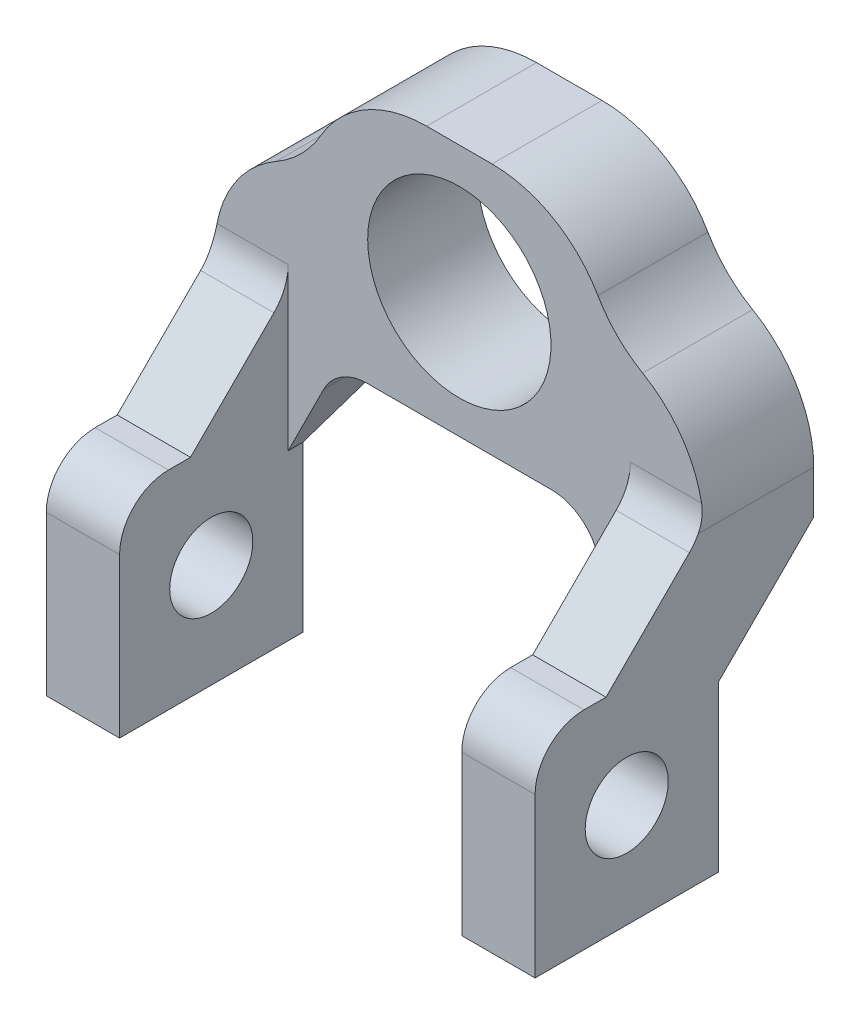
from build123d import *

# Parameters (mm, degrees)
SALIENTE_EXTRUIR1_DEPTH = 20
CORTAR_EXTRUIR1_START   = -6.736039
CROQUIS2_W              = 14
CROQUIS2_H              = 7.5
CORTAR_EXTRUIR1_DEPTH   = 6.736039
CORTAR_EXTRUIR2_REACH   = 29.226
CROQUIS3_R              = 1.7
CROQUIS5_W              = 14
CROQUIS5_H              = 5.763961031
CORTAR_EXTRUIR4_DEPTH   = 10
CORTAR_EXTRUIR3_REACH   = 30.507
CROQUIS4_R              = 3.75
CROQUIS4_W              = 5
CROQUIS4_H              = 5
REDONDEO1_R             = 5
REDONDEO2_R             = 5
REDONDEO3_R             = 2


# Some blends are built 0.0001 mm under size
with BuildPart() as part:
    # Croquis1 → Saliente-Extruir1 (new body)
    with BuildSketch(Plane(origin=(0, 0, 0), x_dir=(0, 0, -1), z_dir=(1, 0, 0))):
        Polygon((-3.75, 4.25), (-0.85, 4.25), (3.15, 8.25), (3.15, 16.813961031), (7.65, 16.813961031), (7.65, 6.386038969), (3.75, 2.486038969), (3.75, -4.25), (-3.75, -4.25), align=None)
    extrude(amount=SALIENTE_EXTRUIR1_DEPTH)

    # Croquis2 → Cortar-Extruir1 (cut)
    with BuildSketch(Plane.XZ.offset(4.25).offset(CORTAR_EXTRUIR1_START)):
        with Locations((10, 0)):
            Rectangle(CROQUIS2_W, CROQUIS2_H)
    extrude(amount=CORTAR_EXTRUIR1_DEPTH, mode=Mode.SUBTRACT)

    # Cortar-Extruir2: up to this face of the body (flat: up to its plane)
    cortar_extruir2_end = Plane(part.part.faces().sort_by_distance((20, 4.974035109, -2.43613322))[0])
    # Croquis3 → Cortar-Extruir2 (cut, up to the picked face)
    with BuildSketch(Plane.ZY, mode=Mode.PRIVATE) as cortar_extruir2_sk1:
        Circle(CROQUIS3_R)
    cortar_extruir2_tool1 = split(extrude(cortar_extruir2_sk1.sketch, amount=-CORTAR_EXTRUIR2_REACH, mode=Mode.PRIVATE), bisect_by=cortar_extruir2_end, keep=Keep.BOTH, mode=Mode.PRIVATE)
    add(cortar_extruir2_tool1.solids().sort_by(Axis((0, 0, 0), (1, 0, 0)))[0], mode=Mode.SUBTRACT)

    # Croquis5 → Cortar-Extruir4 (cut)
    with BuildSketch(Plane.XY.offset(-3.15)):
        with Locations((10, 5.368019484)):
            Rectangle(CROQUIS5_W, CROQUIS5_H)
    extrude(amount=CORTAR_EXTRUIR4_DEPTH, mode=Mode.SUBTRACT)

    # Cortar-Extruir3: up to this face of the body (flat: up to its plane)
    cortar_extruir3_end = Plane(part.part.faces().sort_by_distance((10, 10.237705939, -3.15))[0])
    # Croquis4 → Cortar-Extruir3 (cut, up to the picked face)
    with BuildSketch(Plane(origin=(0, 0, -7.65), x_dir=(-1, 0, 0), z_dir=(0, 0, -1)), mode=Mode.PRIVATE) as cortar_extruir3_sk1:
        with Locations((-10, 11.6)):
            Circle(CROQUIS4_R)
    cortar_extruir3_tool1 = split(extrude(cortar_extruir3_sk1.sketch, amount=-CORTAR_EXTRUIR3_REACH, mode=Mode.PRIVATE), bisect_by=cortar_extruir3_end, keep=Keep.BOTH, mode=Mode.PRIVATE)
    # Croquis4 → Cortar-Extruir3 (cut, up to the picked face)
    with BuildSketch(Plane(origin=(0, 0, -7.65), x_dir=(-1, 0, 0), z_dir=(0, 0, -1)), mode=Mode.PRIVATE) as cortar_extruir3_sk2:
        with Locations((-17.5, 14.313961031)):
            Rectangle(CROQUIS4_W, CROQUIS4_H)
    cortar_extruir3_tool2 = split(extrude(cortar_extruir3_sk2.sketch, amount=-CORTAR_EXTRUIR3_REACH, mode=Mode.PRIVATE), bisect_by=cortar_extruir3_end, keep=Keep.BOTH, mode=Mode.PRIVATE)
    # Croquis4 → Cortar-Extruir3 (cut, up to the picked face)
    with BuildSketch(Plane(origin=(0, 0, -7.65), x_dir=(-1, 0, 0), z_dir=(0, 0, -1)), mode=Mode.PRIVATE) as cortar_extruir3_sk3:
        with Locations((-2.5, 14.313961031)):
            Rectangle(CROQUIS4_W, CROQUIS4_H)
    cortar_extruir3_tool3 = split(extrude(cortar_extruir3_sk3.sketch, amount=-CORTAR_EXTRUIR3_REACH, mode=Mode.PRIVATE), bisect_by=cortar_extruir3_end, keep=Keep.BOTH, mode=Mode.PRIVATE)
    # Croquis4 → Cortar-Extruir3 (cut, up to the picked face)
    with BuildSketch(Plane(origin=(0, 0, -7.65), x_dir=(-1, 0, 0), z_dir=(0, 0, -1)), mode=Mode.PRIVATE) as cortar_extruir3_sk4:
        Polygon((-15, 6.486038969), (-5, 6.486038969), (-3, 2.486038969), (-17, 2.486038969), align=None)
    cortar_extruir3_tool4 = split(extrude(cortar_extruir3_sk4.sketch, amount=-CORTAR_EXTRUIR3_REACH, mode=Mode.PRIVATE), bisect_by=cortar_extruir3_end, keep=Keep.BOTH, mode=Mode.PRIVATE)
    add(cortar_extruir3_tool1.solids().sort_by(Axis((10, 11.6, -7.65), (0, 0, 1)))[0], mode=Mode.SUBTRACT)
    add(cortar_extruir3_tool2.solids().sort_by(Axis((17.5, 14.313961, -7.65), (0, 0, 1)))[0], mode=Mode.SUBTRACT)
    add(cortar_extruir3_tool3.solids().sort_by(Axis((2.5, 14.313961, -7.65), (0, 0, 1)))[0], mode=Mode.SUBTRACT)
    add(cortar_extruir3_tool4.solids().sort_by(Axis((10, 4.374928, -7.65), (0, 0, 1)))[0], mode=Mode.SUBTRACT)

    # Redondeo1
    redondeo1_edges = [part.edges().sort_by_distance(p)[0] for p in [
        (5, 11.813961031, -5.4),
        (15, 11.813961031, -5.4),
    ]]
    fillet(redondeo1_edges, radius=REDONDEO1_R - 0.0001)  # a hair under: the kernel refuses the full size

    # Redondeo2
    # the kernel refuses this fillet: 5 mm, written as the material it takes off along each edge
    with BuildSketch(Plane(origin=(15, 16.813961031, -16.800740757), x_dir=(-1, 0, 0), z_dir=(0, 0, 1))) as redondeo2_piece_1:
        with BuildLine():
            CenterArc((3.660296303, 5), REDONDEO2_R, 209.9996692, 60.0003308)
            Line((-0.66984515, 2.500025), (-1.102859295, 2.2500275))
            ThreePointArc((-1.102859295, 2.2500275), (-0.5, 0.0001), (-0.5, 0))
            Line((-0.5, 0), (0, -0.5))
            Line((0, -0.5), (3.660296303, -0.5))
            Line((3.660296303, -0.5), (3.660296303, 0))
        make_face()
    extrude(amount=22.801481513, mode=Mode.SUBTRACT)
    with BuildSketch(Plane(origin=(5, 16.813961031, -16.800740757), x_dir=(-0.258806597579155, -0.9659291615069406, 0), z_dir=(0, 0, 1)), Plane(origin=(20, 11.813961031, -16.800740757), x_dir=(-0.9659291615069399, 0.25880659757915725, 0), z_dir=(0, 0, 1))) as redondeo2_piece_2:
        with BuildLine():
            CenterArc((3.882336975, 4.829619926), REDONDEO2_R, 194.999261652, 60.0003308)
            Line((-0.947308832, 3.535586938), (-1.430273413, 3.40618364))
            Line((-1.430273413, 3.40618364), (-0.482964581, -0.129403299))
            Line((-0.482964581, -0.129403299), (0.129403299, -0.482964581))
            ThreePointArc((0.129403299, -0.482964581), (0.129499892, -0.4829387), (2.458794439, -0.482961993))
            Line((2.458794439, -0.482961993), (2.588207396, 0))
        make_face()
    extrude(amount=22.801481513, mode=Mode.SUBTRACT)
    with BuildSketch(Plane(origin=(0, 11.813961031, -16.800740757), x_dir=(0.9659291615069402, 0.2588065975791559, 0), z_dir=(0, 0, 1))) as redondeo2_piece_3:
        with BuildLine():
            CenterArc((3.882336975, -4.829619926), REDONDEO2_R, 105.000407548, 60.0003308)
            Line((-0.947308832, -3.535586938), (-1.430273413, -3.40618364))
            Line((-1.430273413, -3.40618364), (-0.482964581, 0.129403299))
            Line((-0.482964581, 0.129403299), (0.129403299, 0.482964581))
            ThreePointArc((0.129403299, 0.482964581), (0.129499892, 0.4829387), (2.458794439, 0.482961993))
            Line((2.458794439, 0.482961993), (2.588207396, 0))
        make_face()
    extrude(amount=22.801481513, mode=Mode.SUBTRACT)

    # Redondeo3
    redondeo3_edges = [part.edges().sort_by_distance(p)[0] for p in [
        (15, 6.486038969, -5.4),
        (5, 6.486038969, -5.4),
        (1.500464067, 8.25, -3.15),
        (18.499535933, 8.25, -3.15),
        (18.5, 4.25, 3.75),
        (1.5, 4.25, 3.75),
    ]]
    fillet(redondeo3_edges, radius=REDONDEO3_R)


solid = part.part
